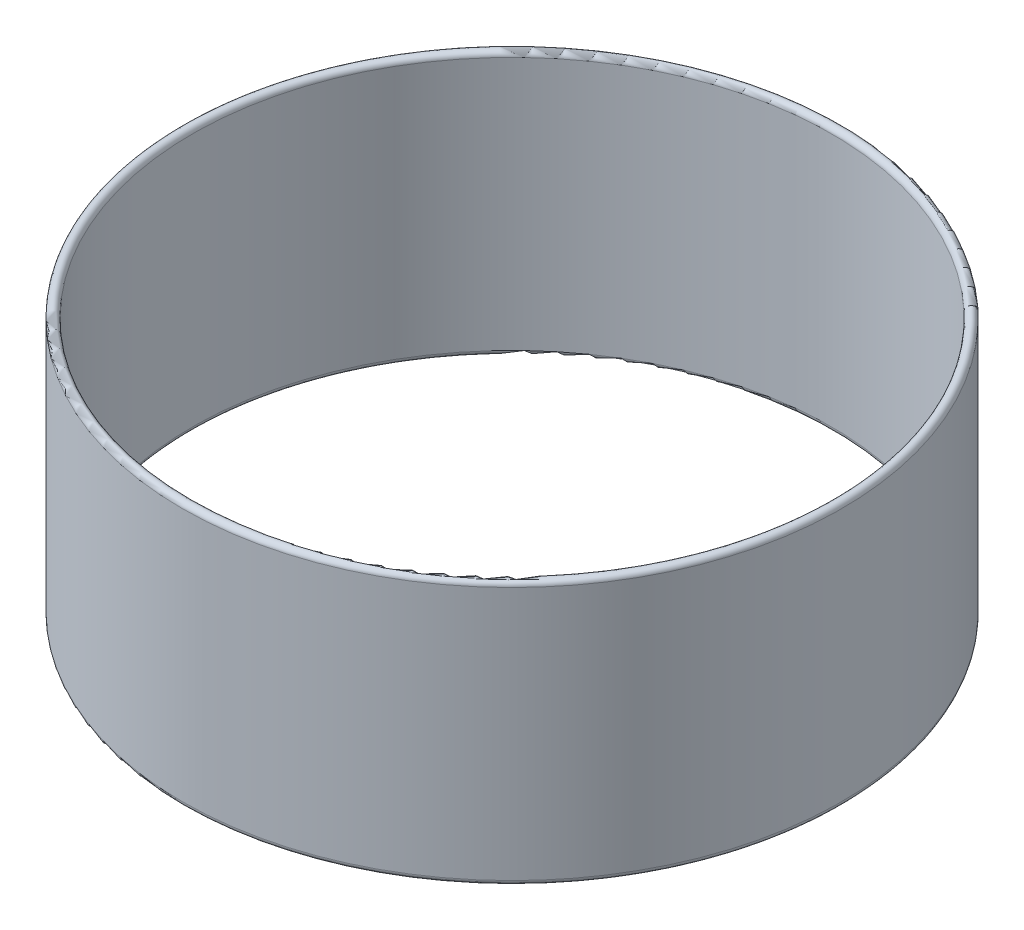
from build123d import *

# Parameters (mm, degrees)
SHIELD_CROSS_SECTION_SKETCH_R   = 100
SHIELD_CROSS_SECTION_SKETCH_R_2 = 97
SHIELD_EXTRUDE_DEPTH            = 80
TOP_FILLET_R                    = 1.5
BOTTOM_FILLET_R                 = 1.5


with BuildPart() as part:
    # Shield Cross Section Sketch → Shield Extrude (new body)
    with BuildSketch(Plane(origin=(0, 0, 0), x_dir=(1, 0, 0), z_dir=(0, 1, 0))):
        with Locations(Location((0, 0, 0), (0, 0, 270))):
            Circle(SHIELD_CROSS_SECTION_SKETCH_R)
        with Locations(Location((0, 0, 0), (0, 0, 270))):
            Circle(SHIELD_CROSS_SECTION_SKETCH_R_2, mode=Mode.SUBTRACT)
    extrude(amount=SHIELD_EXTRUDE_DEPTH)

    # Top Fillet
    top_fillet_edges = [part.edges().sort_by_distance(p)[0] for p in [
        (0, 80, -100),
        (0, 80, -97),
    ]]
    fillet(top_fillet_edges, radius=TOP_FILLET_R - 0.0001)  # a hair under: the kernel refuses the full size

    # Bottom Fillet
    bottom_fillet_edges = [part.edges().sort_by_distance(p)[0] for p in [
        (0, 0, -100),
        (0, 0, -97),
    ]]
    fillet(bottom_fillet_edges, radius=BOTTOM_FILLET_R - 0.0001)  # a hair under: the kernel refuses the full size


solid = part.part
